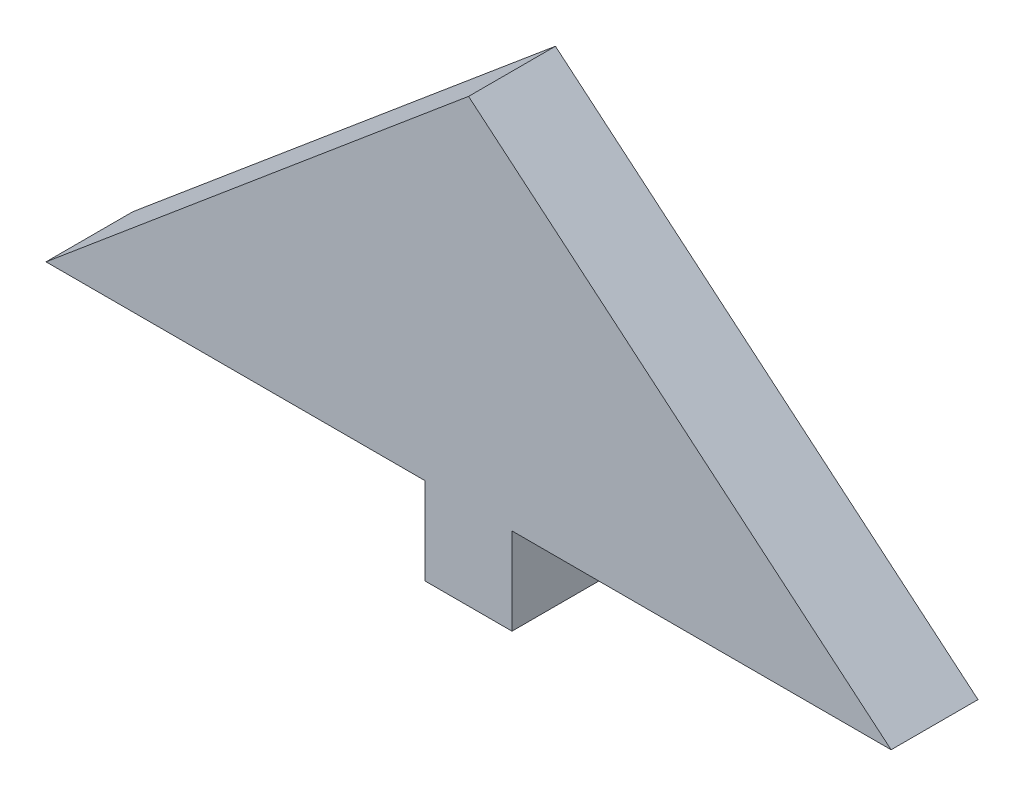
from build123d import *

# Parameters (mm, degrees)
BOSS_EXTRUDE1_DEPTH = 1.5


with BuildPart() as part:
    # Sketch1 → Boss-Extrude1 (new, symmetric)
    with BuildSketch(Plane.XY):
        Polygon((0, 15.245103965), (-14.593146641, 3), (-1.5, 3), (-1.5, 0), (1.5, 0), (1.5, 3), (14.593146641, 3), align=None)
    extrude(amount=BOSS_EXTRUDE1_DEPTH, both=True)


solid = part.part
